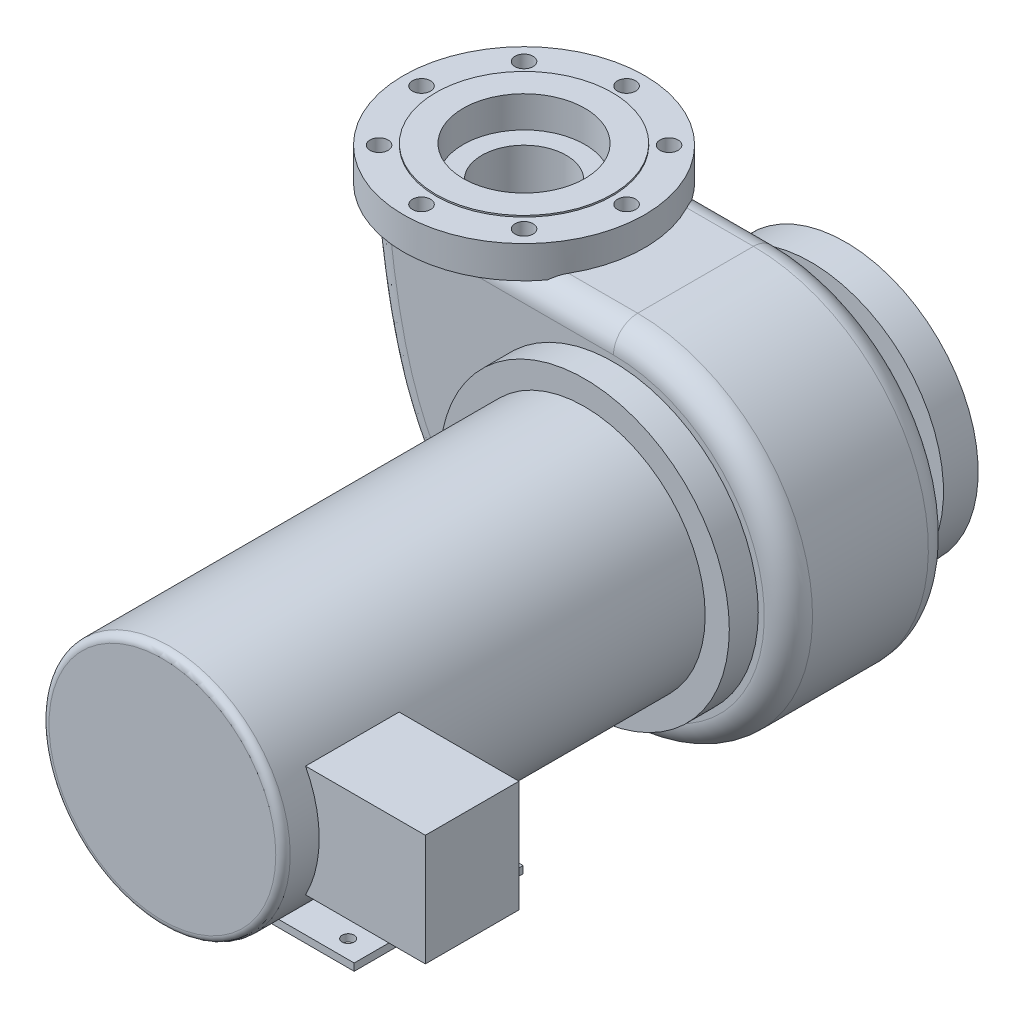
from build123d import *

# Parameters (mm, degrees)
SKETCH1_R              = 127
BOSS_EXTRUDE1_DEPTH    = 444.5
SKETCH2_R              = 6.332600999999995
BOSS_EXTRUDE2_DEPTH    = 7.619999999999974
FILLET1_R              = 7.62
SKETCH3_R              = 152.4
MOTOR_PUMP_PLATE_DEPTH = 30.479999999999997
BOSS_EXTRUDE4_DEPTH    = 172.71999999999997
SKETCH6_R              = 87.3125
BOSS_EXTRUDE5_DEPTH    = 35.0012
FILLET2_R              = 25.4
FILLET3_R              = 25.4
SKETCH7_R              = 139.7
BOSS_EXTRUDE6_DEPTH    = 36.512499999999996
SKETCH8_R              = 92.86875
BOSS_EXTRUDE7_DEPTH    = 1.5875
SKETCH9_R              = 64.0969
CUT_EXTRUDE1_DEPTH     = 38.1
SKETCH19_R             = 54.91107894847043
CUT_EXTRUDE6_DEPTH     = 101.6
SKETCH10_R             = 9.525000000000004
SKETCH10_R_2           = 9.52499999999998
SKETCH10_R_3           = 9.525000000000006
SKETCH10_R_4           = 9.525
SKETCH10_R_5           = 9.525000000000002
SKETCH10_R_6           = 9.524999999999995
SKETCH10_R_7           = 9.52499999999999
CUT_EXTRUDE2_DEPTH     = 36.5125
SKETCH11_R             = 72.60636241576177
BOSS_EXTRUDE8_DEPTH    = 30.162499999999998
SKETCH12_R             = 127
BOSS_EXTRUDE9_DEPTH    = 33.9725
SKETCH13_R             = 92.86875
BOSS_EXTRUDE10_DEPTH   = 1.5875
SKETCH14_R             = 64.09689999999999
CUT_EXTRUDE3_DEPTH     = 33.02
SKETCH15_R             = 44.44999999999998
CUT_EXTRUDE4_DEPTH     = 100.83799999999998
SKETCH16_R             = 9.524999999999991
SKETCH16_R_2           = 9.524999999999986
SKETCH16_R_3           = 9.524999999999984
SKETCH16_R_4           = 9.52500000000004
SKETCH16_R_5           = 9.524999999999938
CUT_EXTRUDE5_DEPTH     = 33.9725
BOSS_EXTRUDE11_DEPTH   = 238.76


with BuildPart() as part:
    # Sketch1 → Boss-Extrude1 (new body)
    with BuildSketch(Plane.XY):
        Circle(SKETCH1_R)
    extrude(amount=-BOSS_EXTRUDE1_DEPTH)

    # Fillet1
    fillet1_edges = [part.edges().sort_by_distance(p)[0] for p in [
        (-127, 1.555e-14, 0),
    ]]
    fillet(fillet1_edges, radius=FILLET1_R)

    # Sketch3 → Motor-pump-plate (add)
    with BuildSketch(Plane(origin=(0, 0, -444.5), x_dir=(-1, 0, 0), z_dir=(0, 0, -1))):
        with Locations(Location((0, 0, 0), (0, 0, 180))):
            Circle(SKETCH3_R)
    extrude(amount=MOTOR_PUMP_PLATE_DEPTH)

    # Sketch5 → Boss-Extrude4 (add)
    with BuildSketch(Plane(origin=(0, 0, -474.98), x_dir=(-1, 0, 0), z_dir=(0, 0, -1))):
        with BuildLine():
            Line((0, 184.15), (264.16, 184.15))
            add(Edge.make_bspline(
                [(264.16, 184.15), (256.1217865711475, 110.71627328254165), (240.98012414491672, -17.330508170507034), (160.1258226775901, -100.30160483341523), (130.213713755503, -130.21371375550248)],
                knots=[0, 0, 0, 0, 0.6553731389606892, 1, 1, 1, 1], degree=3))
            ThreePointArc((130.213713755503, -130.21371375550248), (-170.1324159119534, -70.47115407003145), (0, 184.15))
        make_face()
    extrude(amount=BOSS_EXTRUDE4_DEPTH)

    # Sketch6 → Boss-Extrude5 (add)
    with BuildSketch(Plane(origin=(0, 0, -647.6999999999999), x_dir=(-1, 0, 0), z_dir=(0, 0, -1))):
        with Locations(Location((0, 0, 0), (0, 0, 180))):
            Circle(SKETCH6_R)
    extrude(amount=BOSS_EXTRUDE5_DEPTH)

    # Fillet2
    fillet2_edges = [part.edges().sort_by_distance(p)[0] for p in [
        (170.13241591195333, -70.47115407003145, -647.7),
        (-231.05926421484253, 11.807769395078054, -647.7),
        (-132.08, 184.15, -647.7),
    ]]
    fillet(fillet2_edges, radius=FILLET2_R)

    # Fillet3
    fillet3_edges = [part.edges().sort_by_distance(p)[0] for p in [
        (170.13241591195333, -70.47115407003145, -474.98),
        (-230.77417149669134, 11.022147565989144, -474.98),
        (-132.08, 184.15, -474.98),
    ]]
    fillet(fillet3_edges, radius=FILLET3_R - 0.0001)  # a hair under: the kernel refuses the full size

    # Sketch7 → Boss-Extrude6 (add)
    with BuildSketch(Plane(origin=(0, 0, -682.7011999999999), x_dir=(-1, 0, 0), z_dir=(0, 0, -1))):
        Circle(SKETCH7_R)
    extrude(amount=BOSS_EXTRUDE6_DEPTH)

    # Sketch8 → Boss-Extrude7 (add)
    with BuildSketch(Plane(origin=(0, 0, -719.2136999999998), x_dir=(-1, 0, 0), z_dir=(0, 0, -1))):
        Circle(SKETCH8_R)
    extrude(amount=BOSS_EXTRUDE7_DEPTH)

    # Sketch9 → Cut-Extrude1 (cut)
    with BuildSketch(Plane(origin=(0, 0, -720.8011999999998), x_dir=(-1, 0, 0), z_dir=(0, 0, -1))):
        Circle(SKETCH9_R)
    extrude(amount=-CUT_EXTRUDE1_DEPTH, mode=Mode.SUBTRACT)

    # Sketch19 → Cut-Extrude6 (cut)
    with BuildSketch(Plane(origin=(0, 0, -682.7011999999997), x_dir=(-1, 0, 0), z_dir=(0, 0, -1))):
        Circle(SKETCH19_R)
    extrude(amount=-CUT_EXTRUDE6_DEPTH, mode=Mode.SUBTRACT)

    # Sketch10 → Cut-Extrude2 (cut)
    with BuildSketch(Plane(origin=(0, 0, -719.2136999999998), x_dir=(-1, 0, 0), z_dir=(0, 0, -1))):
        with Locations((0, 107.94999999999999)):
            Circle(SKETCH10_R)
        with Locations((76.33217702908796, 76.33217702908767)):
            Circle(SKETCH10_R_2)
        with Locations((107.94999999999999, -3.7691e-13)):
            Circle(SKETCH10_R_3)
        with Locations((76.3321770290874, -76.33217702908821)):
            Circle(SKETCH10_R_4)
        with Locations((-7.5381e-13, -107.94999999999999)):
            Circle(SKETCH10_R_5)
        with Locations((-76.33217702908847, -76.33217702908716)):
            Circle(SKETCH10_R_6)
        with Locations((-107.94999999999997, 1.13072e-12)):
            Circle(SKETCH10_R)
        with Locations((-76.33217702908688, 76.33217702908873)):
            Circle(SKETCH10_R_7)
    extrude(amount=-CUT_EXTRUDE2_DEPTH, mode=Mode.SUBTRACT)

    # Sketch11 → Boss-Extrude8 (add)
    with BuildSketch(Plane(origin=(0, 184.15, 0), x_dir=(1, 0, 0), z_dir=(0, 1, 0))):
        with Locations(Location((-182.88, 563.6466505219995, 0), (0, 0, 53.884122756))):
            Circle(SKETCH11_R)
    extrude(amount=BOSS_EXTRUDE8_DEPTH)

    # Sketch12 → Boss-Extrude9 (add)
    with BuildSketch(Plane(origin=(0, 214.31250000000003, 0), x_dir=(1, 0, 0), z_dir=(0, 1, 0))):
        with Locations(Location((-182.88, 563.6466505219995, 0), (0, 0, 270))):
            Circle(SKETCH12_R)
    extrude(amount=-BOSS_EXTRUDE9_DEPTH)

    # Sketch13 → Boss-Extrude10 (add)
    with BuildSketch(Plane(origin=(0, 214.31250000000003, 0), x_dir=(1, 0, 0), z_dir=(0, 1, 0))):
        with Locations(Location((-182.88, 563.6466505219995, 0), (0, 0, 270))):
            Circle(SKETCH13_R)
    extrude(amount=BOSS_EXTRUDE10_DEPTH)

    # Sketch14 → Cut-Extrude3 (cut)
    with BuildSketch(Plane(origin=(0, 215.9, 0), x_dir=(1, 0, 0), z_dir=(0, 1, 0))):
        with Locations(Location((-182.88, 563.6466505219995, 0), (0, 0, 270))):
            Circle(SKETCH14_R)
    extrude(amount=-CUT_EXTRUDE3_DEPTH, mode=Mode.SUBTRACT)

    # Sketch15 → Cut-Extrude4 (cut)
    with BuildSketch(Plane(origin=(0, 182.88000000000002, 0), x_dir=(1, 0, 0), z_dir=(0, 1, 0))):
        with Locations(Location((-182.88, 563.6466505219995, 0), (0, 0, 270))):
            Circle(SKETCH15_R)
    extrude(amount=-CUT_EXTRUDE4_DEPTH, mode=Mode.SUBTRACT)

    # Sketch16 → Cut-Extrude5 (cut)
    with BuildSketch(Plane(origin=(0, 214.31250000000003, 0), x_dir=(1, 0, 0), z_dir=(0, 1, 0))):
        with Locations(Location((-182.88, 671.5966505219994, 0), (0, 0, 270))):
            Circle(SKETCH16_R)
        with Locations(Location((-106.5478229709117, 639.9788275510881, 0), (0, 0, 270))):
            Circle(SKETCH16_R_2)
        with Locations(Location((-74.92999999999839, 563.6466505220005, 0), (0, 0, 270))):
            Circle(SKETCH16_R_3)
        with Locations(Location((-106.54782297091015, 487.3144734929123, 0), (0, 0, 270))):
            Circle(SKETCH16_R_4)
        with Locations(Location((-182.8799999999977, 455.69665052199946, 0), (0, 0, 270))):
            Circle(SKETCH16_R_3)
        with Locations(Location((-259.2121770290858, 487.31447349291125, 0), (0, 0, 270))):
            Circle(SKETCH16_R_5)
        with Locations(Location((-290.8299999999985, 563.6466505219992, 0), (0, 0, 270))):
            Circle(SKETCH16_R_3)
        with Locations(Location((-259.2121770290865, 639.9788275510872, 0), (0, 0, 270))):
            Circle(SKETCH16_R_4)
    extrude(amount=-CUT_EXTRUDE5_DEPTH, mode=Mode.SUBTRACT)

    # Sketch18 → Boss-Extrude11 (add)
    with BuildSketch(Plane(origin=(0, 0, 0), x_dir=(0, 0, -1), z_dir=(1, 0, 0))):
        Polygon((38.10000000000001, 58.67399999999998), (136.652, 58.67400000000002), (136.652, -58.67399999999998), (38.100000000000016, -58.67400000000002), align=None)
    extrude(amount=BOSS_EXTRUDE11_DEPTH)


with BuildPart() as body_2:
    # Sketch2 → Boss-Extrude2 (new body)
    with BuildSketch(Plane(origin=(0, -133.35, 0), x_dir=(-1, 0, 0), z_dir=(0, 1, 0))):
        Polygon((133.34999999999997, -68.58), (-133.35000000000002, -68.58), (-133.35, -246.38000000000002), (133.35000000000002, -246.38), align=None)
        with Locations(Location((-107.94999999999996, -227.33, 0), (0, 0, 90))):
            Circle(SKETCH2_R, mode=Mode.SUBTRACT)
        with Locations(Location((107.95000000000002, -227.32999999999697, 0), (0, 0, 90))):
            Circle(SKETCH2_R, mode=Mode.SUBTRACT)
        with Locations(Location((-107.95000000000044, -87.63000000000001, 0), (0, 0, 90))):
            Circle(SKETCH2_R, mode=Mode.SUBTRACT)
        with Locations(Location((107.94999999999952, -87.62999999999698, 0), (0, 0, 90))):
            Circle(SKETCH2_R, mode=Mode.SUBTRACT)
    extrude(amount=BOSS_EXTRUDE2_DEPTH)


solid = Compound([part.part, body_2.part])
